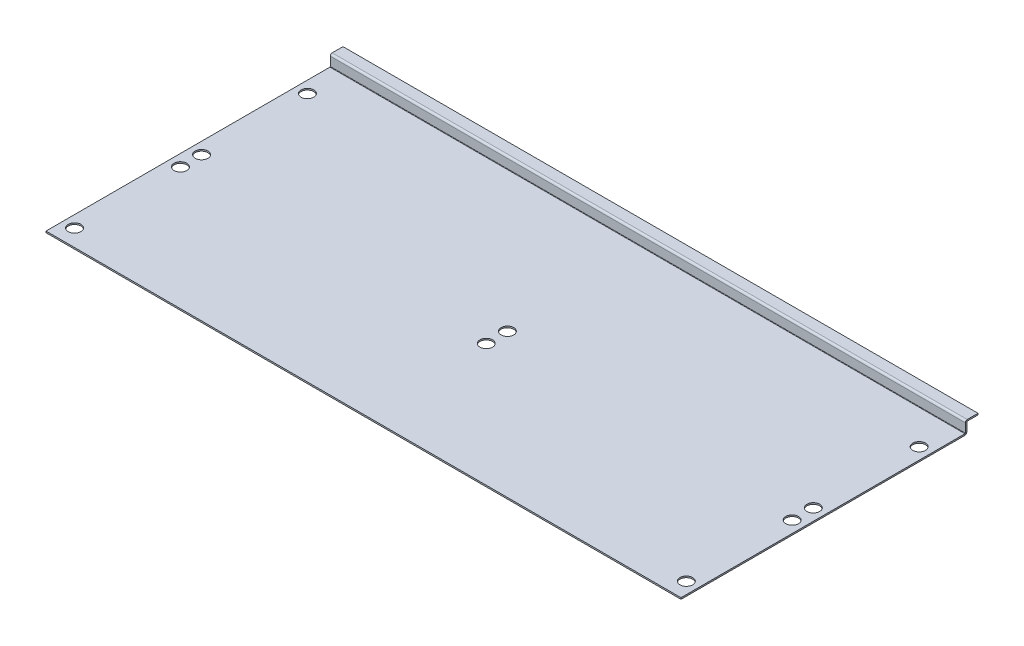
from build123d import *
from build123d.topology import SkipClean

# Parameters (mm, degrees)
SKETCH_1_W                       = 300
SKETCH_1_H                       = 135
SKETCH_1_R                       = 3
SM_BASE_FLANGE_1_DEPTH           = 0.7
SM_EDGE_FLANGE_1_STRIP_W         = 3.2
SM_EDGE_FLANGE_1_STRIP_H         = 0.7
SM_EDGE_FLANGE_1_STRIP_CUT_DEPTH = 300
SM_EDGE_FLANGE_1_DEPTH           = 300
SM_EDGE_FLANGE_2_STRIP_W         = 3.2
SM_EDGE_FLANGE_2_STRIP_H         = 0.7
SM_EDGE_FLANGE_2_STRIP_CUT_DEPTH = 300
SM_EDGE_FLANGE_2_DEPTH           = 300
MOVE_START                       = -0.5
MOVE_BODY_1_OUTLINE_W            = 300
MOVE_BODY_1_OUTLINE_H            = 134.3
MOVE_BODY_1_OUTLINE_R            = 3
MOVE_BODY_1_DEPTH                = 0.5
MOVE_START_2                     = -6
MOVE_BODY_1_2_OUTLINE_W          = 300
MOVE_BODY_1_2_OUTLINE_H          = 6
MOVE_BODY_1_2_DEPTH              = 4.6
MOVE_START_3                     = -1.343604
MOVE_BODY_1_3_OUTLINE_W          = 300
MOVE_BODY_1_3_OUTLINE_H          = 134.3
MOVE_BODY_1_3_OUTLINE_R          = 3
MOVE_BODY_1_3_DEPTH              = 0.643604
MOVE_BODY_1_4_OUTLINE_W          = 300
MOVE_BODY_1_4_OUTLINE_H          = 0.7
MOVE_BODY_1_4_DEPTH              = 4.2
MOVE_START_4                     = -1.4
MOVE_BODY_1_5_OUTLINE_W          = 300
MOVE_BODY_1_5_OUTLINE_H          = 134.3
MOVE_BODY_1_5_OUTLINE_R          = 3
MOVE_BODY_1_5_DEPTH              = 0.056396
MOVE_START_5                     = 3.7
MOVE_BODY_1_6_OUTLINE_W          = 300
MOVE_BODY_1_6_OUTLINE_H          = 6
MOVE_BODY_1_6_DEPTH              = 0.9
MOVE_START_6                     = -0.7
MOVE_BODY_1_7_OUTLINE_W          = 300
MOVE_BODY_1_7_OUTLINE_H          = 0.7
MOVE_BODY_1_7_DEPTH              = 0.2
MOVE_START_7                     = -151
MOVE_BODY_1_8_DEPTH              = 301


with BuildPart() as part:
    # 基体-法兰1: sheet metal written as solids
    # 草图1 → 基体-法兰1 (new body)
    with BuildSketch(Plane(origin=(0, 0, 0), x_dir=(1, 0, 0), z_dir=(0, 1, 0))):
        Rectangle(SKETCH_1_W, SKETCH_1_H)
        with Locations(Location((-144.5, -59.5, 0), (0, 0, 270))):
            Circle(SKETCH_1_R, mode=Mode.SUBTRACT)
        with Locations(Location((-144.5, -9.5, 0), (0, 0, 270))):
            Circle(SKETCH_1_R, mode=Mode.SUBTRACT)
        with Locations(Location((-144.5, 0.5, 0), (0, 0, 270))):
            Circle(SKETCH_1_R, mode=Mode.SUBTRACT)
        with Locations(Location((-144.5, 50.5, 0), (0, 0, 270))):
            Circle(SKETCH_1_R, mode=Mode.SUBTRACT)
        with Locations(Location((0, -9.5, 0), (0, 0, 270))):
            Circle(SKETCH_1_R, mode=Mode.SUBTRACT)
        with Locations(Location((0, 0.5, 0), (0, 0, 270))):
            Circle(SKETCH_1_R, mode=Mode.SUBTRACT)
        with Locations(Location((144.5, -59.5, 0), (0, 0, 90))):
            Circle(SKETCH_1_R, mode=Mode.SUBTRACT)
        with Locations(Location((144.5, -9.5, 0), (0, 0, 90))):
            Circle(SKETCH_1_R, mode=Mode.SUBTRACT)
        with Locations(Location((144.5, 0.5, 0), (0, 0, 90))):
            Circle(SKETCH_1_R, mode=Mode.SUBTRACT)
        with Locations(Location((144.5, 50.5, 0), (0, 0, 90))):
            Circle(SKETCH_1_R, mode=Mode.SUBTRACT)
    extrude(amount=-SM_BASE_FLANGE_1_DEPTH)

    # 边线-法兰1: sheet metal written as solids
    # 边线-法兰1 strip (on a plane across the edge) → 边线-法兰1 strip cut (cut)
    with BuildSketch(Plane(origin=(-150, -0.7, -67.5), x_dir=(0, 0, 1), z_dir=(1, 0, 0))):
        with Locations((-0.7, -0.35)):
            Rectangle(SM_EDGE_FLANGE_1_STRIP_W, SM_EDGE_FLANGE_1_STRIP_H)
    extrude(amount=SM_EDGE_FLANGE_1_STRIP_CUT_DEPTH, mode=Mode.SUBTRACT)

    # 边线-法兰1 section (on a plane across the edge) → 边线-法兰1 (add)
    with BuildSketch(Plane(origin=(-150, -0.7, -67.5), x_dir=(0, 0, 1), z_dir=(1, 0, 0))):
        with BuildLine():
            Line((0, 0.2), (0, 5.3))
            Line((0, 5.3), (0.7, 5.3))
            Line((0.7, 5.3), (0.7, 0.2))
            ThreePointArc((0.7, 0.2), (0.758578644, 0.058578644), (0.9, 0))
            Line((0.9, 0), (0.9, -0.7))
            ThreePointArc((0.9, -0.7), (0.263603897, -0.436396103), (0, 0.2))
        make_face()
    extrude(amount=SM_EDGE_FLANGE_1_DEPTH)

    # 边线-法兰2: sheet metal written as solids
    # 边线-法兰2 strip (on a plane across the edge) → 边线-法兰2 strip cut (cut)
    with BuildSketch(Plane(origin=(150, -6, -67.5), x_dir=(0, 1, 0), z_dir=(-1, 0, 0))):
        with Locations((-0.7, -0.35)):
            Rectangle(SM_EDGE_FLANGE_2_STRIP_W, SM_EDGE_FLANGE_2_STRIP_H)
    extrude(amount=SM_EDGE_FLANGE_2_STRIP_CUT_DEPTH, mode=Mode.SUBTRACT)

    # 边线-法兰2 section (on a plane across the edge) → 边线-法兰2 (add)
    with BuildSketch(Plane(origin=(150, -6, -67.5), x_dir=(0, 1, 0), z_dir=(-1, 0, 0))):
        with BuildLine():
            Line((0, 0.2), (0, 5.3))
            Line((0, 5.3), (0.7, 5.3))
            Line((0.7, 5.3), (0.7, 0.2))
            ThreePointArc((0.7, 0.2), (0.758578644, 0.058578644), (0.9, 0))
            Line((0.9, 0), (0.9, -0.7))
            ThreePointArc((0.9, -0.7), (0.263603897, -0.436396103), (0, 0.2))
        make_face()
    extrude(amount=SM_EDGE_FLANGE_2_DEPTH)

    # Move Body 1: read off the stored shape, not the designer's step
    # Move Body 1 outline → Move Body 1 (cut)
    with BuildSketch(Plane(origin=(0, 0, 0), x_dir=(1, 0, 0), z_dir=(0, 1, 0)).offset(MOVE_START)):
        with Locations((0, -0.35)):
            Rectangle(MOVE_BODY_1_OUTLINE_W, MOVE_BODY_1_OUTLINE_H)
        with Locations((-144.5, -59.5)):
            Circle(MOVE_BODY_1_OUTLINE_R, mode=Mode.SUBTRACT)
        with Locations((-144.5, -9.5)):
            Circle(MOVE_BODY_1_OUTLINE_R, mode=Mode.SUBTRACT)
        with Locations((-144.5, 0.5)):
            Circle(MOVE_BODY_1_OUTLINE_R, mode=Mode.SUBTRACT)
        with Locations((144.5, -59.5)):
            Circle(MOVE_BODY_1_OUTLINE_R, mode=Mode.SUBTRACT)
        with Locations((0, -9.5)):
            Circle(MOVE_BODY_1_OUTLINE_R, mode=Mode.SUBTRACT)
        with Locations((0, 0.5)):
            Circle(MOVE_BODY_1_OUTLINE_R, mode=Mode.SUBTRACT)
        with Locations((144.5, -9.5)):
            Circle(MOVE_BODY_1_OUTLINE_R, mode=Mode.SUBTRACT)
        with Locations((144.5, 0.5)):
            Circle(MOVE_BODY_1_OUTLINE_R, mode=Mode.SUBTRACT)
        with Locations((-144.5, 50.5)):
            Circle(MOVE_BODY_1_OUTLINE_R, mode=Mode.SUBTRACT)
        with Locations((144.5, 50.5)):
            Circle(MOVE_BODY_1_OUTLINE_R, mode=Mode.SUBTRACT)
    extrude(amount=MOVE_BODY_1_DEPTH, mode=Mode.SUBTRACT)

    # Move Body 1 2 outline → Move Body 1 2 (cut)
    with BuildSketch(Plane(origin=(0, 0, 0), x_dir=(1, 0, 0), z_dir=(0, 1, 0)).offset(MOVE_START_2)):
        with Locations((0, 69.8)):
            Rectangle(MOVE_BODY_1_2_OUTLINE_W, MOVE_BODY_1_2_OUTLINE_H)
    extrude(amount=MOVE_BODY_1_2_DEPTH, mode=Mode.SUBTRACT)

    # Move Body 1 3 outline → Move Body 1 3 (add)
    with SkipClean():  # the faces are left unmerged after this step: merging them gives an invalid solid
        with BuildSketch(Plane(origin=(0, 0, 0), x_dir=(1, 0, 0), z_dir=(0, 1, 0)).offset(MOVE_START_3)):
            with Locations((0, -0.35)):
                Rectangle(MOVE_BODY_1_3_OUTLINE_W, MOVE_BODY_1_3_OUTLINE_H)
            with Locations((-144.5, -59.5)):
                Circle(MOVE_BODY_1_3_OUTLINE_R, mode=Mode.SUBTRACT)
            with Locations((-144.5, -9.5)):
                Circle(MOVE_BODY_1_3_OUTLINE_R, mode=Mode.SUBTRACT)
            with Locations((-144.5, 0.5)):
                Circle(MOVE_BODY_1_3_OUTLINE_R, mode=Mode.SUBTRACT)
            with Locations((144.5, -59.5)):
                Circle(MOVE_BODY_1_3_OUTLINE_R, mode=Mode.SUBTRACT)
            with Locations((0, -9.5)):
                Circle(MOVE_BODY_1_3_OUTLINE_R, mode=Mode.SUBTRACT)
            with Locations((0, 0.5)):
                Circle(MOVE_BODY_1_3_OUTLINE_R, mode=Mode.SUBTRACT)
            with Locations((144.5, -9.5)):
                Circle(MOVE_BODY_1_3_OUTLINE_R, mode=Mode.SUBTRACT)
            with Locations((144.5, 0.5)):
                Circle(MOVE_BODY_1_3_OUTLINE_R, mode=Mode.SUBTRACT)
            with Locations((-144.5, 50.5)):
                Circle(MOVE_BODY_1_3_OUTLINE_R, mode=Mode.SUBTRACT)
            with Locations((144.5, 50.5)):
                Circle(MOVE_BODY_1_3_OUTLINE_R, mode=Mode.SUBTRACT)
        extrude(amount=MOVE_BODY_1_3_DEPTH)

    # Move Body 1 4 outline → Move Body 1 4 (add)
    with SkipClean():  # the faces are left unmerged after this step: merging them gives an invalid solid
        with BuildSketch(Plane(origin=(0, 0, 0), x_dir=(1, 0, 0), z_dir=(0, 1, 0)).offset(MOVE_START)):
            with Locations((0, 67.15)):
                Rectangle(MOVE_BODY_1_4_OUTLINE_W, MOVE_BODY_1_4_OUTLINE_H)
        extrude(amount=MOVE_BODY_1_4_DEPTH)

    # Move Body 1 5 outline → Move Body 1 5 (add)
    with SkipClean():  # the faces are left unmerged after this step: merging them gives an invalid solid
        with BuildSketch(Plane(origin=(0, 0, 0), x_dir=(1, 0, 0), z_dir=(0, 1, 0)).offset(MOVE_START_4)):
            with Locations((0, -0.35)):
                Rectangle(MOVE_BODY_1_5_OUTLINE_W, MOVE_BODY_1_5_OUTLINE_H)
            with Locations((-144.5, -59.5)):
                Circle(MOVE_BODY_1_5_OUTLINE_R, mode=Mode.SUBTRACT)
            with Locations((-144.5, -9.5)):
                Circle(MOVE_BODY_1_5_OUTLINE_R, mode=Mode.SUBTRACT)
            with Locations((-144.5, 0.5)):
                Circle(MOVE_BODY_1_5_OUTLINE_R, mode=Mode.SUBTRACT)
            with Locations((144.5, -59.5)):
                Circle(MOVE_BODY_1_5_OUTLINE_R, mode=Mode.SUBTRACT)
            with Locations((0, -9.5)):
                Circle(MOVE_BODY_1_5_OUTLINE_R, mode=Mode.SUBTRACT)
            with Locations((0, 0.5)):
                Circle(MOVE_BODY_1_5_OUTLINE_R, mode=Mode.SUBTRACT)
            with Locations((144.5, -9.5)):
                Circle(MOVE_BODY_1_5_OUTLINE_R, mode=Mode.SUBTRACT)
            with Locations((144.5, 0.5)):
                Circle(MOVE_BODY_1_5_OUTLINE_R, mode=Mode.SUBTRACT)
            with Locations((-144.5, 50.5)):
                Circle(MOVE_BODY_1_5_OUTLINE_R, mode=Mode.SUBTRACT)
            with Locations((144.5, 50.5)):
                Circle(MOVE_BODY_1_5_OUTLINE_R, mode=Mode.SUBTRACT)
        extrude(amount=MOVE_BODY_1_5_DEPTH)

    # Move Body 1 6 outline → Move Body 1 6 (add)
    with SkipClean():  # the faces are left unmerged after this step: merging them gives an invalid solid
        with BuildSketch(Plane(origin=(0, 0, 0), x_dir=(1, 0, 0), z_dir=(0, 1, 0)).offset(MOVE_START_5)):
            with Locations((0, 69.8)):
                Rectangle(MOVE_BODY_1_6_OUTLINE_W, MOVE_BODY_1_6_OUTLINE_H)
        extrude(amount=MOVE_BODY_1_6_DEPTH)

    # Move Body 1 7 outline → Move Body 1 7 (add)
    with SkipClean():  # the faces are left unmerged after this step: merging them gives an invalid solid
        with BuildSketch(Plane(origin=(0, 0, 0), x_dir=(1, 0, 0), z_dir=(0, 1, 0)).offset(MOVE_START_6)):
            with Locations((0, 67.15)):
                Rectangle(MOVE_BODY_1_7_OUTLINE_W, MOVE_BODY_1_7_OUTLINE_H)
        extrude(amount=MOVE_BODY_1_7_DEPTH)

    # Move Body 1 8 outline → Move Body 1 8 (cut)
    with BuildSketch(Plane.YZ.offset(MOVE_START_7)):
        with BuildLine():
            Line((-0.5, 67.5), (-0.7, 67.5))
            Line((-0.7, 67.5), (-0.7, -66.6))
            ThreePointArc((-0.7, -66.6), (-0.641421356, -66.741421356), (-0.5, -66.8))
            Line((-0.5, -66.8), (-0.5, 67.5))
        make_face()
        with BuildLine():
            ThreePointArc((-0.7, -67.477496439), (-1.203562364, -67.161248608), (-1.4, -66.6))
            Line((-1.4, -66.6), (-1.4, -67.5))
            Line((-1.4, -67.5), (-0.9, -67.5))
            ThreePointArc((-0.9, -67.5), (-0.799368978, -67.494356415), (-0.7, -67.477496439))
        make_face()
        with BuildLine():
            Line((4.6, -66.8), (3.7, -66.8))
            ThreePointArc((3.7, -66.8), (4.336396103, -67.063603897), (4.6, -67.7))
            Line((4.6, -67.7), (4.6, -66.8))
        make_face()
        with BuildLine():
            ThreePointArc((-0.5, -67.5), (-0.600631022, -67.494356415), (-0.7, -67.477496439))
            Line((-0.7, -67.477496439), (-0.7, -67.5))
            Line((-0.7, -67.5), (-0.5, -67.5))
        make_face()
        with BuildLine():
            ThreePointArc((3.9, -67.7), (3.841421356, -67.558578644), (3.7, -67.5))
            Line((3.7, -67.5), (3.7, -72.8))
            Line((3.7, -72.8), (3.9, -72.8))
            Line((3.9, -72.8), (3.9, -67.7))
        make_face()
    extrude(amount=MOVE_BODY_1_8_DEPTH, mode=Mode.SUBTRACT)


solid = part.part
